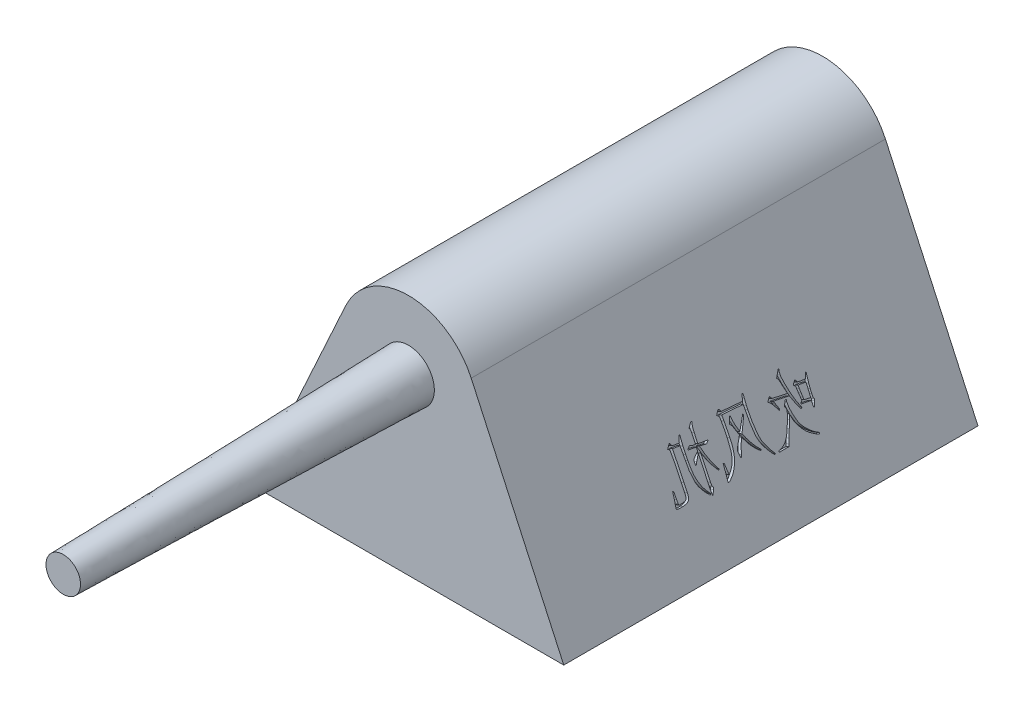
from build123d import *

# Parameters (mm, degrees)
SKETCH_1_W               = 120
SKETCH_1_H               = 120
EXTRUDE_1_DEPTH          = 60
CUT_EXTRUDE_1_DEPTH      = 181.0000001
CUT_EXTRUDE_1_DEPTH_BACK = 181.0000001
CUT_EXTRUDE_START        = -1
CUT_EXTRUDE_2_DEPTH      = 189.58894894


with BuildPart() as part:
    # 草图1 → 凸台-拉伸1 (new, symmetric)
    with BuildSketch(Plane.XY):
        with Locations((0, 60)):
            Rectangle(SKETCH_1_W, SKETCH_1_H)
    extrude(amount=EXTRUDE_1_DEPTH, both=True)

    # 放样1: read off the stored shape, not the designer's step
    # 放样1: loft between two sections, ruled curve by curve
    loft_1_from = [
        Edge.make_bspline([(4.574429183, 56.193449978, 60), (-7.312470774, 65.342308345, 60), (-16.46132914, 53.455408388, 60), (-4.574429183, 44.306550022, 60), (7.312470774, 35.157691655, 60), (16.46132914, 47.044591612, 60), (4.574429183, 56.193449978, 60)], [0, 0, 0, 0, 0.5, 0.5, 0.5, 1, 1, 1, 1], 3, [1, 0.333333333, 0.333333333, 1, 0.333333333, 0.333333333, 1]),
    ]
    loft_1_to = [
        Edge.make_bspline([(1.470201626, 55.028965074, 160), (-8.087728522, 57.969368326, 160), (-11.028131774, 48.411438178, 160), (-1.470201626, 45.471034926, 160), (8.087728522, 42.530631674, 160), (11.028131774, 52.088561822, 160), (1.470201626, 55.028965074, 160)], [0, 0, 0, 0, 0.5, 0.5, 0.5, 1, 1, 1, 1], 3, [1, 0.333333333, 0.333333333, 1, 0.333333333, 0.333333333, 1]),
    ]
    loft_1 = Solid(Shell([*[Face.make_surface_from_curves(loft_1_from[k], loft_1_to[k]) for k in range(1)], Face(Wire(loft_1_from)), Face(Wire(loft_1_to))]))
    add(loft_1)

    # 草图5 → 切除-拉伸1 (cut, two sides: drawn at the far end of the back side and taken through both)
    with BuildSketch(Plane.XY.offset(60).offset(-CUT_EXTRUDE_1_DEPTH_BACK)):
        with BuildLine():
            Line((-45, 0), (-18.185043309, 58.574914406))
            ThreePointArc((-18.185043309, 58.574914406), (0, 70.25), (18.185043309, 58.574914406))
            Line((18.185043309, 58.574914406), (45, 0))
            Line((45, 0), (60, 0))
            Line((60, 0), (60, 120))
            Line((60, 120), (-60, 120))
            Line((-60, 120), (-60, 0))
            Line((-60, 0), (-45, 0))
        make_face()
    extrude(amount=CUT_EXTRUDE_1_DEPTH + CUT_EXTRUDE_1_DEPTH_BACK, mode=Mode.SUBTRACT)

    # 草图6 → 切除-拉伸2 (cut)
    # profile 1 of 7: a face of its own
    with BuildSketch(Plane(origin=(-37.203277515, 17.031254514, 0), x_dir=(0, 0, 1), z_dir=(-0.9092521654318725, 0.4162457202872492, 0)).offset(CUT_EXTRUDE_START)):
        with BuildLine():
            Line((-21.544781071, 9.01724255), (-20.332718225, 9.171275537))
            Line((-20.332718225, 9.171275537), (-19.405995174, 9.322783392))
            Line((-19.405995174, 9.322783392), (-19.032275796, 9.88588759))
            add(Edge.make_bspline(
                [(-19.032275796, 9.88588759), (-19.014364065, 9.910011793), (-18.981033162, 9.954903125), (-18.894228659, 9.974480172), (-18.803901999, 9.941126115), (-18.753582279, 9.895086034), (-18.724209823, 9.868211673)],
                knots=[0, 0, 0, 0, 0.955847125, 1.778680574, 2.70337894, 4, 4, 4, 4], degree=3))
            Line((-18.724209823, 9.868211673), (-18.239384684, 9.358135226))
            add(Edge.make_bspline(
                [(-18.239384684, 9.358135226), (-18.208844668, 9.32630229), (-18.160215476, 9.275614371), (-18.132531419, 9.182858182), (-18.160284973, 9.112640134), (-18.209687108, 9.050222371), (-18.290388018, 8.981569889), (-18.393481748, 8.90716381), (-18.495197123, 8.827922988), (-18.574249325, 8.746092339), (-18.599003415, 8.630344322), (-18.622482992, 8.47342935), (-18.653359332, 8.235669115), (-18.669517408, 8.050151103), (-18.678757466, 7.944061905)],
                knots=[0, 0, 0, 0, 0.963202408, 1.53371736, 2.002232805, 2.557823776, 3.279141685, 4.323659278, 5.35045927, 6.140102405, 6.737918749, 7.900979441, 9.655959124, 12, 12, 12, 12], degree=3))
            Line((-18.678757466, 7.944061905), (-18.789863227, 6.936534664))
            Line((-18.789863227, 6.936534664), (-18.943896214, 5.863354019))
            Line((-18.943896214, 5.863354019), (-18.98682344, 5.368428357))
            Line((-18.98682344, 5.368428357), (-18.570176836, 4.959357146))
            add(Edge.make_bspline(
                [(-18.570176836, 4.959357146), (-18.540317188, 4.926565605), (-18.491933395, 4.873431049), (-18.459679545, 4.780146945), (-18.499809924, 4.710099711), (-18.545366549, 4.706357139), (-18.570176836, 4.704318922)],
                knots=[0, 0, 0, 0, 1.544190069, 2.502165192, 3.184274256, 4, 4, 4, 4], degree=3))
            Line((-18.570176836, 4.704318922), (-18.855516631, 4.67149222))
            Line((-18.855516631, 4.67149222), (-19.451447531, 4.603313685))
            Line((-19.451447531, 4.603313685), (-20.332718225, 4.4821074))
            Line((-20.332718225, 4.4821074), (-21.325094681, 4.277571795))
            Line((-21.325094681, 4.277571795), (-21.345295728, 3.785171264))
            Line((-21.345295728, 3.785171264), (-21.345295728, 3.323072303))
            add(Edge.make_bspline(
                [(-21.345295728, 3.323072303), (-21.345193494, 3.22617815), (-21.345000857, 3.043603485), (-21.387596717, 2.854013683), (-21.396968263, 2.706501259), (-21.478629624, 2.686545507), (-21.530487421, 2.778901692), (-21.565316126, 2.841152148), (-21.587708297, 2.881174391)],
                knots=[0, 0, 0, 0, 1.919209401, 3.616307091, 4.190654597, 4.487084434, 5.027311972, 6, 6, 6, 6], degree=3))
            Line((-21.587708297, 2.881174391), (-21.918500449, 3.494781207))
            Line((-21.918500449, 3.494781207), (-22.117985793, 3.921528334))
            add(Edge.make_bspline(
                [(-22.117985793, 3.921528334), (-22.134739935, 3.952323918), (-22.164136121, 4.006356688), (-22.193281073, 4.080964032), (-22.214531501, 4.133838518), (-22.220205814, 4.192677064), (-22.17434383, 4.272069196), (-22.109734919, 4.394199395), (-22.028756879, 4.570291867), (-21.999304211, 4.759749344), (-21.979468398, 4.940473836), (-21.970154312, 5.109926635), (-21.965889926, 5.30695523), (-21.964626203, 5.447545357), (-21.963952806, 5.522461343)],
                knots=[0, 0, 0, 0, 0.756838903, 1.327920955, 1.730710729, 1.986106387, 2.574043189, 3.624075137, 5.026598719, 6.714534166, 7.739352734, 8.960668023, 10.380437117, 12, 12, 12, 12], degree=3))
            Line((-21.963952806, 5.522461343), (-21.963952806, 6.68149644))
            Line((-21.963952806, 6.68149644), (-22.02960621, 7.926385988))
            add(Edge.make_bspline(
                [(-22.02960621, 7.926385988), (-22.031372589, 7.931412669), (-22.037137777, 7.947818981), (-22.043451906, 7.982613361), (-22.051312917, 8.037297102), (-22.057574861, 8.112480542), (-22.068779672, 8.208228917), (-22.078121743, 8.323634013), (-22.088606231, 8.459123024), (-22.100643901, 8.657025389), (-22.116358895, 8.891040795), (-22.133823596, 9.133473435), (-22.148523388, 9.316182043), (-22.162904484, 9.458451934), (-22.180382553, 9.60004913), (-22.209138508, 9.776566922), (-22.24688424, 10.00904148), (-22.277632577, 10.181374394), (-22.294744958, 10.277282884)],
                knots=[0, 0, 0, 0, 0.107894965, 0.352152582, 0.714043297, 1.228386643, 1.880236556, 2.6679437, 3.574678763, 4.634578627, 6.686285865, 8.328364293, 9.560919656, 10.401185252, 11.226423052, 12.452111758, 14.025492656, 16, 16, 16, 16], degree=3))
            Line((-22.294744958, 10.277282884), (-22.072533436, 10.380813252))
            Line((-22.072533436, 10.380813252), (-21.787193641, 9.681351985))
            Line((-21.787193641, 9.681351985), (-21.544781071, 9.01724255))
        make_face()
        Polygon((-21.368021906, 4.926530444), (-19.605480517, 5.249747203), (-19.517100935, 5.898705852), (-19.405995174, 6.868356129), (-19.297414544, 7.926385988), (-19.251962187, 8.676349874), (-20.663510377, 8.504640971), (-21.456401489, 8.368283901), (-21.456401489, 7.398633624), align=None, mode=Mode.SUBTRACT)
    # profile 2 of 7: a face of its own
    with BuildSketch(Plane(origin=(-37.203277515, 17.031254514, 0), x_dir=(0, 0, 1), z_dir=(-0.9092521654318725, 0.4162457202872492, 0)).offset(CUT_EXTRUDE_START)):
        with BuildLine():
            add(Edge.make_bspline(
                [(-14.20675059, 6.050213708), (-14.236119691, 6.010602565), (-14.290250146, 5.93759491), (-14.365676028, 5.838283128), (-14.417592786, 5.751331452), (-14.46211678, 5.675350655), (-14.497429569, 5.586575996), (-14.536714567, 5.468618719), (-14.590683764, 5.313727396), (-14.626405329, 5.196032675), (-14.646123371, 5.131066049)],
                knots=[0, 0, 0, 0, 1.151034013, 2.12148119, 2.906428436, 3.513111957, 4.173390575, 5.130023566, 6.41579397, 8, 8, 8, 8], degree=3))
            add(Edge.make_bspline(
                [(-14.646123371, 5.131066049), (-14.630262933, 5.084725986), (-14.595609271, 4.983477023), (-14.536612589, 4.821088168), (-14.475047911, 4.633106338), (-14.399820866, 4.420255344), (-14.310913473, 4.171345384), (-14.192781755, 3.884343651), (-14.05786264, 3.548532733), (-13.893412271, 3.173059175), (-13.706981366, 2.75865514), (-13.502281441, 2.308021833), (-13.277965991, 1.824646703), (-13.038925295, 1.317606785), (-12.783450741, 0.810618848), (-12.491053843, 0.338863114), (-12.181009948, -0.09653895), (-11.847197379, -0.485947551), (-11.496657835, -0.82804743), (-11.123108522, -1.101858859), (-10.736057634, -1.316639839), (-10.46285162, -1.405575905), (-10.328149482, -1.449425154)],
                knots=[0, 0, 0, 0, 0.361530957, 0.78991334, 1.275204663, 1.821455053, 2.456307885, 3.225843721, 4.111933012, 5.127622296, 6.251146752, 7.466183313, 8.781009372, 10.184448305, 11.604416628, 12.968366785, 14.277086751, 15.54603214, 16.750074257, 17.883382359, 18.956417836, 20, 20, 20, 20], degree=3))
            Line((-10.328149482, -1.449425154), (-9.886251569, -1.568106307))
            Line((-9.886251569, -1.568106307), (-9.378700252, -1.686787461))
            Line((-9.378700252, -1.686787461), (-9.40142643, -2.01000422))
            Line((-9.40142643, -2.01000422), (-9.754944761, -2.01000422))
            Line((-9.754944761, -2.01000422), (-11.605865732, -1.994853434))
            Line((-11.605865732, -1.994853434), (-12.244723857, -1.994853434))
            Line((-12.244723857, -1.994853434), (-12.44168407, -1.464575939))
            Line((-12.44168407, -1.464575939), (-12.906308161, -0.373719378))
            Line((-12.906308161, -0.373719378), (-13.699199273, 1.398922535))
            Line((-13.699199273, 1.398922535), (-14.426436981, 3.118536698))
            Line((-14.426436981, 3.118536698), (-14.865809762, 4.194242474))
            add(Edge.make_bspline(
                [(-14.865809762, 4.194242474), (-14.894144116, 4.081380659), (-14.95345122, 3.84514773), (-15.052008018, 3.477296875), (-15.163583377, 3.080738981), (-15.264625183, 2.731126785), (-15.363349865, 2.436671965), (-15.453715351, 2.199336031), (-15.569454112, 1.954494343), (-15.696720266, 1.695088208), (-15.848527698, 1.428869065), (-16.010364832, 1.146387473), (-16.199325449, 0.85869766), (-16.464586053, 0.460608437), (-16.818150294, -0.019293692), (-17.266760213, -0.554217803), (-17.73542979, -1.032550723), (-18.226096544, -1.466641212), (-18.761960978, -1.862589278), (-19.3481455, -2.25004125), (-20.00228475, -2.625826932), (-20.466248462, -2.860626407), (-20.706437603, -2.982179628)],
                knots=[0, 0, 0, 0, 0.725578599, 1.518720553, 2.374476111, 3.294438929, 3.787374669, 4.310774756, 4.876756707, 5.475287604, 6.111996682, 6.787111913, 7.504846396, 8.257427852, 9.770084747, 11.218933763, 12.607008462, 13.942067027, 15.299317642, 16.757906356, 18.321602176, 20, 20, 20, 20], degree=3))
            Line((-20.706437603, -2.982179628), (-20.840269542, -2.658962869))
            add(Edge.make_bspline(
                [(-20.840269542, -2.658962869), (-20.620902994, -2.541485823), (-20.168848279, -2.299397623), (-19.512389667, -1.850984683), (-18.852040128, -1.326626087), (-18.308595781, -0.837964016), (-17.887034738, -0.41694211), (-17.589053847, -0.095491723), (-17.317382766, 0.230868128), (-17.067504328, 0.556278459), (-16.844681845, 0.886848893), (-16.644345791, 1.217274072), (-16.468886168, 1.550899712), (-16.277380365, 1.991584183), (-16.072324031, 2.520937368), (-15.855552234, 3.120414506), (-15.682529729, 3.672184965), (-15.551335875, 4.172577016), (-15.456706597, 4.61744578), (-15.373154654, 4.997857201), (-15.314922292, 5.315487146), (-15.265576937, 5.644460089), (-15.227350528, 5.987062522), (-15.21061558, 6.297526334), (-15.204968685, 6.510658678), (-15.199177862, 6.636854354), (-15.196195923, 6.736193071), (-15.196480552, 6.79344279), (-15.196601914, 6.81785351)],
                knots=[0, 0, 0, 0, 1.670327638, 3.442090376, 5.329726787, 7.331136143, 8.346480277, 9.330657216, 10.273793721, 11.197551925, 12.0850147, 12.949825357, 13.791848953, 14.614385065, 16.175426639, 17.604121897, 18.895083644, 20.057844479, 21.076943021, 21.949534565, 22.673608081, 23.24525281, 24.18356523, 24.987592942, 25.332623598, 25.615509762, 25.836057126, 26, 26, 26, 26], degree=3))
            Line((-15.196601914, 6.81785351), (-15.242054271, 7.226924721))
            Line((-15.242054271, 7.226924721), (-15.02236788, 7.330455089))
            Line((-15.02236788, 7.330455089), (-14.20675059, 6.050213708))
        make_face()
    # profile 3 of 7: a face of its own
    with BuildSketch(Plane(origin=(-37.203277515, 17.031254514, 0), x_dir=(0, 0, 1), z_dir=(-0.9092521654318725, 0.4162457202872492, 0)).offset(CUT_EXTRUDE_START)):
        with BuildLine():
            add(Edge.make_bspline(
                [(-18.459071075, 4.040209488), (-18.29009409, 4.352142622), (-17.955635375, 4.969556617), (-17.595061426, 5.773953142), (-17.329744657, 6.438562766), (-17.128623835, 6.972350426), (-16.934136431, 7.546299288), (-16.736951495, 8.146732213), (-16.550717082, 8.755354928), (-16.380880439, 9.351253416), (-16.232667364, 9.924165665), (-16.121809414, 10.38428153), (-16.044439983, 10.73185958), (-15.990728367, 10.967385506), (-15.943616891, 11.181370642), (-15.899175516, 11.372770393), (-15.865998797, 11.542789216), (-15.83095456, 11.688404573), (-15.807282649, 11.813683857), (-15.763997874, 12.002273444), (-15.71926822, 12.249125183), (-15.70891213, 12.463853154), (-15.704153231, 12.562526375)],
                knots=[0, 0, 0, 0, 2.363647401, 4.678403234, 5.869030614, 7.132887299, 8.479332593, 9.907347447, 11.344642176, 12.720813804, 14.036490827, 15.288226456, 15.874767141, 16.409590551, 16.898169653, 17.335031251, 17.718988848, 18.052415481, 18.332949358, 18.5684171, 19.34214953, 20, 20, 20, 20], degree=3))
            Line((-15.704153231, 12.562526375), (-15.704153231, 12.817564599))
            add(Edge.make_bspline(
                [(-15.704153231, 12.817564599), (-15.704153231, 12.850391301), (-15.704153231, 12.908469313), (-15.704153231, 12.984223241), (-15.704153231, 13.03640928), (-15.704153231, 13.06334401), (-15.704153231, 13.072602823)],
                knots=[0, 0, 0, 0, 1.544554455, 2.732673267, 3.564356436, 4, 4, 4, 4], degree=3))
            add(Edge.make_bspline(
                [(-15.704153231, 13.072602823), (-15.70660177, 13.121512908), (-15.711909868, 13.227543299), (-15.741371349, 13.396594791), (-15.790134294, 13.587140803), (-15.834531433, 13.719316714), (-15.858186218, 13.789740007)],
                knots=[0, 0, 0, 0, 0.797400045, 1.728654511, 2.789827683, 4, 4, 4, 4], degree=3))
            Line((-15.858186218, 13.789740007), (-15.681427053, 13.890745244))
            Line((-15.681427053, 13.890745244), (-14.580469967, 12.307488151))
            add(Edge.make_bspline(
                [(-14.580469967, 12.307488151), (-14.617783028, 12.262274573), (-14.687236521, 12.178115276), (-14.779436648, 12.058109022), (-14.846816418, 11.95103679), (-14.902744409, 11.857182019), (-14.945797945, 11.75747123), (-14.986233827, 11.641418485), (-15.038929677, 11.505585333), (-15.070899117, 11.406211316), (-15.088021284, 11.35298866)],
                knots=[0, 0, 0, 0, 1.288957823, 2.399230266, 3.323161076, 4.06910296, 4.798097321, 5.70557479, 6.77115359, 8, 8, 8, 8], degree=3))
            Line((-15.088021284, 11.35298866), (-15.284981497, 10.75453263))
            Line((-15.284981497, 10.75453263), (-15.550120244, 9.800033138))
            Line((-15.550120244, 9.800033138), (-15.923839622, 8.640998041))
            Line((-15.923839622, 8.640998041), (-16.057671561, 8.249602747))
            Line((-16.057671561, 8.249602747), (-15.242054271, 8.368283901))
            Line((-15.242054271, 8.368283901), (-13.633545869, 8.658673958))
            Line((-13.633545869, 8.658673958), (-12.398756844, 8.898561396))
            Line((-12.398756844, 8.898561396), (-11.848278301, 8.999566633))
            Line((-11.848278301, 8.999566633), (-11.560413375, 9.476816379))
            add(Edge.make_bspline(
                [(-11.560413375, 9.476816379), (-11.547570413, 9.499240445), (-11.524543739, 9.539445471), (-11.487605988, 9.583952822), (-11.459768264, 9.617171604), (-11.411739267, 9.625374717), (-11.342593499, 9.578355911), (-11.287635854, 9.538049236), (-11.252347402, 9.512168212)],
                knots=[0, 0, 0, 0, 1.128210815, 2.02281538, 2.572202457, 2.949078882, 4.040995371, 6, 6, 6, 6], degree=3))
            Line((-11.252347402, 9.512168212), (-10.656416503, 8.898561396))
            add(Edge.make_bspline(
                [(-10.656416503, 8.898561396), (-10.627078701, 8.87013924), (-10.580199182, 8.824722851), (-10.551387673, 8.738042991), (-10.582643374, 8.67126641), (-10.617085086, 8.642066248), (-10.636215455, 8.625847256)],
                knots=[0, 0, 0, 0, 1.478409305, 2.362382767, 3.090398811, 4, 4, 4, 4], degree=3))
            Line((-10.636215455, 8.625847256), (-10.833175668, 8.504640971))
            add(Edge.make_bspline(
                [(-10.833175668, 8.504640971), (-10.877048509, 8.475539985), (-10.976103306, 8.409836642), (-11.118571922, 8.268261501), (-11.275818783, 8.083485723), (-11.447776139, 7.857163174), (-11.631629069, 7.596290879), (-11.829096895, 7.309253432), (-12.03289324, 6.994489867), (-12.172431979, 6.776668743), (-12.244723857, 6.663820524)],
                knots=[0, 0, 0, 0, 0.540554081, 1.220446954, 2.055412814, 3.037412428, 4.142664018, 5.338752017, 6.621267348, 8, 8, 8, 8], degree=3))
            Line((-12.244723857, 6.663820524), (-12.509862605, 6.221922611))
            Line((-12.509862605, 6.221922611), (-12.684096639, 5.931532554))
            Line((-12.684096639, 5.931532554), (-12.926509208, 6.118392243))
            Line((-12.926509208, 6.118392243), (-12.772476222, 6.444134133))
            Line((-12.772476222, 6.444134133), (-12.509862605, 7.040065032))
            Line((-12.509862605, 7.040065032), (-12.133618096, 7.840531537))
            Line((-12.133618096, 7.840531537), (-11.936657884, 8.28495458))
            Line((-11.936657884, 8.28495458), (-12.618443235, 8.199100129))
            Line((-12.618443235, 8.199100129), (-13.896159485, 7.994564523))
            Line((-13.896159485, 7.994564523), (-15.792532814, 7.671347764))
            Line((-15.792532814, 7.671347764), (-16.320285178, 7.55014148))
            add(Edge.make_bspline(
                [(-16.320285178, 7.55014148), (-16.336950532, 7.507986772), (-16.374421701, 7.413204131), (-16.440979561, 7.257362039), (-16.519092549, 7.069240861), (-16.612237374, 6.850263531), (-16.72131436, 6.600493519), (-16.844153153, 6.317794581), (-16.992162596, 6.007366955), (-17.145536563, 5.67925103), (-17.293538869, 5.368563555), (-17.426118387, 5.107395558), (-17.529407286, 4.907963283), (-17.606670124, 4.77863704), (-17.665319433, 4.691894686), (-17.709121912, 4.615431488), (-17.765674128, 4.525648934), (-17.828211045, 4.417376819), (-17.904796233, 4.296499699), (-17.984265007, 4.155820215), (-18.07641766, 4.001682849), (-18.140149567, 3.8929615), (-18.17373128, 3.835673882)],
                knots=[0, 0, 0, 0, 0.654120707, 1.470755945, 2.445298151, 3.59366084, 4.904718708, 6.378531444, 8.041345517, 9.867074198, 11.605582955, 13.007095096, 14.093869913, 14.845888038, 15.179425463, 15.604386984, 16.116857518, 16.710557414, 17.408438874, 18.181355744, 19.041717206, 20, 20, 20, 20], degree=3))
            Line((-18.17373128, 3.835673882), (-18.459071075, 4.040209488))
        make_face()
    # profile 4 of 7: a face of its own
    with BuildSketch(Plane(origin=(-37.203277515, 17.031254514, 0), x_dir=(0, 0, 1), z_dir=(-0.9092521654318725, 0.4162457202872492, 0)).offset(CUT_EXTRUDE_START)):
        with BuildLine():
            Line((-4.405707399, 11.676205419), (1.611679606, 12.08527663))
            Line((1.611679606, 12.08527663), (1.942471758, 12.663531612))
            add(Edge.make_bspline(
                [(1.942471758, 12.663531612), (1.967013263, 12.698019416), (2.005165429, 12.751634075), (2.071170209, 12.815584716), (2.130433668, 12.79892788), (2.1842974, 12.764708975), (2.255790884, 12.705952515), (2.308890984, 12.657885308), (2.338917314, 12.63070491)],
                knots=[0, 0, 0, 0, 1.51839777, 2.360497612, 2.807088493, 3.513210676, 4.593803816, 6, 6, 6, 6], degree=3))
            Line((2.338917314, 12.63070491), (2.801016274, 12.08527663))
            add(Edge.make_bspline(
                [(2.801016274, 12.08527663), (2.826624972, 12.054452285), (2.871482939, 12.000458228), (2.92553565, 11.926430137), (2.959018877, 11.873541005), (2.970331618, 11.826130825), (2.941624951, 11.785930463), (2.898878206, 11.737371781), (2.832068644, 11.667520389), (2.745520678, 11.590384304), (2.655987712, 11.510688127), (2.58438249, 11.43489484), (2.528480201, 11.374699661), (2.491616411, 11.319284038), (2.466584511, 11.258265955), (2.445531511, 11.182420649), (2.420418113, 11.086432605), (2.389841861, 10.965225165), (2.365666779, 10.805578975), (2.34316007, 10.597579686), (2.326644187, 10.33638464), (2.319871885, 10.144312095), (2.316191136, 10.039920577)],
                knots=[0, 0, 0, 0, 1.044024242, 1.828785125, 2.378039035, 2.688000948, 3.011610686, 3.586922041, 4.408467306, 5.509813933, 6.611160561, 7.525679535, 8.224641931, 8.747458651, 9.248217446, 9.934697367, 10.79592307, 11.832559166, 13.18737996, 14.995417318, 17.280006944, 20, 20, 20, 20], degree=3))
            Line((2.316191136, 10.039920577), (2.207610506, 7.95921269))
            add(Edge.make_bspline(
                [(2.207610506, 7.95921269), (2.195578655, 7.706740985), (2.171763236, 7.207007442), (2.180541134, 6.706787446), (2.184884327, 6.459284918)],
                knots=[0, 0, 0, 0, 1.010425292, 2, 2, 2, 2], degree=3))
            add(Edge.make_bspline(
                [(2.184884327, 6.459284918), (2.184694289, 6.38016325), (2.184283877, 6.209290255), (2.187883855, 5.935744123), (2.189596201, 5.62598064), (2.196170295, 5.155340888), (2.218154846, 4.513566897), (2.256812557, 3.841976032), (2.318820513, 3.271747258), (2.406292221, 2.817726761), (2.532042851, 2.34648184), (2.683748135, 1.868839147), (2.85803083, 1.413416329), (3.042717984, 1.005403789), (3.236533517, 0.659365981), (3.438108969, 0.371989619), (3.64368228, 0.135851121), (3.828260821, -0.078432017), (4.006049078, -0.261814471), (4.166754751, -0.420551151), (4.308627592, -0.541902222), (4.421049773, -0.639633989), (4.49297707, -0.692230326), (4.551563901, -0.746562073), (4.603565485, -0.683438263), (4.618475302, -0.577725061), (4.662701753, -0.397784972), (4.684615151, -0.253370455), (4.697389602, -0.169183772)],
                knots=[0, 0, 0, 0, 0.727184827, 1.570445271, 2.514270048, 3.574216181, 5.896307797, 8.415753772, 9.755312442, 11.164816641, 12.66028939, 14.235854405, 15.768794861, 17.139553625, 18.348575729, 19.408860575, 20.358752996, 21.224771452, 22.007179924, 22.707448978, 23.294009877, 23.738746288, 24.03595404, 24.195248211, 24.32118131, 24.65391963, 25.215300206, 26, 26, 26, 26], degree=3))
            Line((4.697389602, -0.169183772), (4.939802172, 1.959501601))
            Line((4.939802172, 1.959501601), (5.202415788, 1.959501601))
            add(Edge.make_bspline(
                [(5.202415788, 1.959501601), (5.212694986, 1.790327515), (5.232075304, 1.471368035), (5.256648463, 1.02270326), (5.279064272, 0.632277214), (5.288829452, 0.298721729), (5.303718619, 0.016890384), (5.311137437, -0.216496403), (5.325274192, -0.404868019), (5.332920411, -0.515124959), (5.336247728, -0.563104197)],
                knots=[0, 0, 0, 0, 1.61013961, 3.035744439, 4.268851562, 5.325134228, 6.205647194, 6.950000574, 7.543083886, 8, 8, 8, 8], degree=3))
            Line((5.336247728, -0.563104197), (5.42462731, -1.568106307))
            Line((5.42462731, -1.568106307), (5.444828358, -1.790317829))
            Line((5.444828358, -1.790317829), (5.467554536, -2.06303197))
            add(Edge.make_bspline(
                [(5.467554536, -2.06303197), (5.466502381, -2.087700315), (5.464706239, -2.129811814), (5.445011605, -2.183296038), (5.407339771, -2.218987269), (5.375680337, -2.216076052), (5.358973906, -2.214539825)],
                knots=[0, 0, 0, 0, 1.358784943, 2.319590991, 3.113261534, 4, 4, 4, 4], degree=3))
            add(Edge.make_bspline(
                [(5.358973906, -2.214539825), (5.331801479, -2.212288872), (5.269990868, -2.207168505), (5.171084955, -2.168976714), (5.052083995, -2.117217759), (4.917563397, -2.038871178), (4.761174254, -1.946520505), (4.591428177, -1.826130367), (4.401788649, -1.686476028), (4.118836519, -1.47489646), (3.76581686, -1.164186035), (3.370572322, -0.729810522), (2.998477332, -0.23862146), (2.661165763, 0.306530423), (2.36244535, 0.881816328), (2.109789488, 1.470372905), (1.912294082, 2.064271788), (1.770167205, 2.658314468), (1.67482787, 3.235931647), (1.596947794, 3.782198837), (1.545585735, 4.292691699), (1.520693141, 4.764649992), (1.51573086, 5.189973309), (1.512455675, 5.562011104), (1.513953738, 5.876890187), (1.52040195, 6.0678979), (1.523300024, 6.153744076)],
                knots=[0, 0, 0, 0, 0.199367275, 0.453511681, 0.771755619, 1.153648345, 1.594706742, 2.105732644, 2.680702738, 3.324889984, 4.700296345, 6.126691685, 7.631437191, 9.219892363, 10.829155661, 12.388532576, 13.919265133, 15.420196, 16.86951677, 18.217671881, 19.472565446, 20.636446415, 21.687569896, 22.596362086, 23.369151409, 24, 24, 24, 24], degree=3))
            add(Edge.make_bspline(
                [(1.523300024, 6.153744076), (1.524428264, 6.441610401), (1.526665109, 7.012333017), (1.537742844, 7.732101295), (1.558883842, 8.329621383), (1.579030969, 8.826239262), (1.604502092, 9.373349264), (1.624133842, 9.754589416), (1.634405785, 9.954066125)],
                knots=[0, 0, 0, 0, 1.362701216, 2.701685936, 3.407336604, 4.192917911, 5.054478424, 6, 6, 6, 6], degree=3))
            Line((1.634405785, 9.954066125), (1.720260236, 11.385815362))
            Line((1.720260236, 11.385815362), (-4.360255042, 11.012095984))
            add(Edge.make_bspline(
                [(-4.360255042, 11.012095984), (-4.361197617, 10.928768193), (-4.363168447, 10.754538098), (-4.364179578, 10.482612428), (-4.373014234, 10.188036181), (-4.383067793, 9.879158165), (-4.392435479, 9.57106574), (-4.403303816, 9.28157202), (-4.410781645, 9.017260521), (-4.41559778, 8.808521631), (-4.417319134, 8.638373831), (-4.427274389, 8.492077926), (-4.432392318, 8.323521679), (-4.44747145, 8.133527527), (-4.458853515, 7.921294554), (-4.473485694, 7.686346582), (-4.495525566, 7.429886302), (-4.513577522, 7.1518235), (-4.5406543, 6.854071803), (-4.566273867, 6.535538464), (-4.603990808, 6.198403821), (-4.639532534, 5.841909844), (-4.687455605, 5.467821389), (-4.734022512, 5.073626819), (-4.787819387, 4.660437018), (-4.843363141, 4.232106793), (-4.912198965, 3.797597713), (-5.002225014, 3.365624888), (-5.117605608, 2.941796246), (-5.247825479, 2.522908681), (-5.402671348, 2.112139211), (-5.576853524, 1.706291063), (-5.774405173, 1.308705464), (-6.061760512, 0.784956329), (-6.462405048, 0.147917068), (-6.979513987, -0.600191633), (-7.539437681, -1.330460607), (-7.945844365, -1.794186702), (-8.150476568, -2.027680137)],
                knots=[0, 0, 0, 0, 0.643311217, 1.345099554, 2.099091928, 2.918222345, 3.730858298, 4.478552766, 5.15460107, 5.772025204, 6.09048182, 6.467855794, 6.903642021, 7.392055902, 7.938833953, 8.544382109, 9.209189182, 9.925830726, 10.69531496, 11.51714696, 12.392586214, 13.313940401, 14.282695427, 15.303836807, 16.378170512, 17.499293331, 18.638034166, 19.773507552, 20.903613825, 22.027726586, 23.158598482, 24.290794989, 25.435729351, 26.584382177, 28.901387761, 31.240951927, 33.603743914, 36, 36, 36, 36], degree=3))
            Line((-8.150476568, -2.027680137), (-8.349961911, -1.805468615))
            add(Edge.make_bspline(
                [(-8.349961911, -1.805468615), (-8.294600916, -1.739487945), (-8.173544849, -1.595210185), (-7.991669822, -1.348351497), (-7.784179078, -1.061946579), (-7.601248319, -0.792320602), (-7.445273704, -0.550922111), (-7.316010798, -0.348370052), (-7.178717633, -0.12888101), (-7.039600116, 0.109885186), (-6.891668342, 0.365037035), (-6.735057409, 0.635940758), (-6.574867555, 0.926296215), (-6.406084052, 1.231080982), (-6.242720284, 1.554182076), (-6.089605383, 1.896298677), (-5.955232389, 2.257321562), (-5.830505247, 2.635273905), (-5.7194096, 3.031121368), (-5.624796685, 3.445261235), (-5.540604312, 3.876331656), (-5.472336525, 4.318967884), (-5.414379286, 4.760637482), (-5.357017946, 5.187067024), (-5.311399149, 5.593264691), (-5.263533041, 5.977464842), (-5.227051876, 6.341343666), (-5.192771083, 6.683733573), (-5.169033367, 7.005550259), (-5.138023933, 7.402603668), (-5.108298545, 7.876420004), (-5.087161024, 8.427099269), (-5.070148883, 8.958219058), (-5.068233158, 9.305935934), (-5.067291703, 9.476816379)],
                knots=[0, 0, 0, 0, 0.687098235, 1.502455122, 2.445607629, 3.509284093, 4.10168848, 4.738885665, 5.426607298, 6.167257443, 6.94367742, 7.780062668, 8.663986714, 9.589688239, 10.55985875, 11.552073306, 12.578697182, 13.63214657, 14.727228973, 15.857879503, 17.020959161, 18.231156619, 19.430815691, 20.575443145, 21.664267115, 22.692274124, 23.664650652, 24.582227538, 25.437834575, 26.239353828, 27.760141548, 29.225536708, 30.636530014, 32, 32, 32, 32], degree=3))
            Line((-5.067291703, 9.476816379), (-5.067291703, 10.413639954))
            add(Edge.make_bspline(
                [(-5.067291703, 10.413639954), (-5.070815443, 10.535684023), (-5.077400895, 10.763769895), (-5.084311716, 11.082815567), (-5.091809124, 11.356379199), (-5.099613902, 11.583603967), (-5.105544897, 11.76540023), (-5.106599018, 11.900963787), (-5.110526429, 11.990988894), (-5.110293592, 12.035614631), (-5.110218929, 12.049924797)],
                knots=[0, 0, 0, 0, 1.790160024, 3.345596489, 4.678964125, 5.80262674, 6.679202086, 7.345743105, 7.790198984, 8, 8, 8, 8], degree=3))
            Line((-5.110218929, 12.049924797), (-5.175872333, 13.158457275))
            Line((-5.175872333, 13.158457275), (-4.933459763, 13.176133191))
            Line((-4.933459763, 13.176133191), (-4.405707399, 11.676205419))
        make_face()
    # profile 5 of 7: a face of its own
    with BuildSketch(Plane(origin=(-37.203277515, 17.031254514, 0), x_dir=(0, 0, 1), z_dir=(-0.9092521654318725, 0.4162457202872492, 0)).offset(CUT_EXTRUDE_START)):
        with BuildLine():
            add(Edge.make_bspline(
                [(-1.408376986, 6.239598527), (-1.354709213, 6.372341096), (-1.251114609, 6.628573338), (-1.111460968, 7.003627743), (-0.980352379, 7.35068679), (-0.871567124, 7.674491531), (-0.770738446, 7.968672526), (-0.690809853, 8.238874274), (-0.62080467, 8.481320473), (-0.52685786, 8.899307486), (-0.412170325, 9.482174792), (-0.339769667, 9.996641241), (-0.304894769, 10.244456182)],
                knots=[0, 0, 0, 0, 1.030271669, 1.988727683, 2.879842816, 3.6996614, 4.44665973, 5.117316417, 5.727177847, 6.261977282, 8.199420231, 10, 10, 10, 10], degree=3))
            Line((-0.304894769, 10.244456182), (-0.107934557, 10.277282884))
            Line((-0.107934557, 10.277282884), (0.530923568, 8.74452841))
            add(Edge.make_bspline(
                [(0.530923568, 8.74452841), (0.479037764, 8.686921088), (0.378672033, 8.575487894), (0.243408761, 8.408048013), (0.127905674, 8.247556872), (0.045633279, 8.114159168), (-0.012418051, 7.998986735), (-0.06226125, 7.898504886), (-0.12200777, 7.78187325), (-0.183375328, 7.646328928), (-0.252492939, 7.493187454), (-0.32750587, 7.323195267), (-0.408307023, 7.135127591), (-0.522527306, 6.872285304), (-0.655842918, 6.555218996), (-0.802262278, 6.209263823), (-0.926835265, 5.917047924), (-0.999494475, 5.738859424), (-1.032132477, 5.658818413)],
                knots=[0, 0, 0, 0, 1.069596706, 2.06898315, 2.968127237, 3.796698399, 4.227815779, 4.747196615, 5.344484576, 6.035573426, 6.799698966, 7.662871788, 8.599198905, 9.623972963, 11.617103263, 13.344893696, 14.807345074, 16, 16, 16, 16], degree=3))
            Line((-1.032132477, 5.658818413), (0.50819739, 3.34074822))
            add(Edge.make_bspline(
                [(0.50819739, 3.34074822), (0.534910575, 3.295583638), (0.581386652, 3.217005494), (0.636094452, 3.108256158), (0.680541149, 3.017034657), (0.687351508, 2.912084169), (0.678983008, 2.7767568), (0.670094007, 2.67160915), (0.664755508, 2.60846025)],
                knots=[0, 0, 0, 0, 1.218498449, 2.119965317, 2.839522687, 3.548355801, 4.527607294, 6, 6, 6, 6], degree=3))
            Line((0.664755508, 2.60846025), (0.487996343, 1.482251856))
            add(Edge.make_bspline(
                [(0.487996343, 1.482251856), (0.477283075, 1.429834482), (0.458519844, 1.338030623), (0.421417222, 1.221760031), (0.374637026, 1.145661907), (0.315343089, 1.109648926), (0.258258996, 1.120283383), (0.213419536, 1.153987466), (0.176624045, 1.207767369), (0.164150161, 1.252697378), (0.157204191, 1.27771625)],
                knots=[0, 0, 0, 0, 1.92489692, 3.371267028, 4.371105961, 5.089040675, 5.701501688, 6.331676069, 7.071008786, 8, 8, 8, 8], degree=3))
            Line((0.157204191, 1.27771625), (0.023372252, 1.739815211))
            add(Edge.make_bspline(
                [(0.023372252, 1.739815211), (-0.062711595, 2.004400116), (-0.237511312, 2.54165964), (-0.563642636, 3.340597281), (-0.935607371, 4.151867471), (-1.218860805, 4.687123697), (-1.362924629, 4.959357146)],
                knots=[0, 0, 0, 0, 0.950725092, 1.930518715, 2.947453576, 4, 4, 4, 4], degree=3))
            add(Edge.make_bspline(
                [(-1.362924629, 4.959357146), (-1.398472274, 4.904771082), (-1.474043117, 4.788726409), (-1.589903959, 4.601640291), (-1.715865132, 4.391361033), (-1.853836725, 4.160689935), (-2.002321151, 3.911248653), (-2.160947903, 3.64531523), (-2.333869427, 3.366281782), (-2.515751237, 3.063545101), (-2.735398423, 2.737893904), (-3.006341444, 2.384046652), (-3.331814821, 1.993456787), (-3.636960419, 1.654789422), (-3.893589145, 1.376792161), (-4.083091677, 1.18152215), (-4.259071861, 0.998970234), (-4.425494876, 0.833560628), (-4.585297298, 0.688769989), (-4.730740074, 0.556152838), (-4.867677617, 0.442155406), (-4.956830702, 0.373468626), (-4.999113168, 0.340892676)],
                knots=[0, 0, 0, 0, 0.66063575, 1.404447467, 2.231617105, 3.146627505, 4.130449784, 5.175756327, 6.28699079, 7.459740638, 8.757219543, 10.268221799, 11.977674551, 13.912340013, 14.890889059, 15.81461857, 16.671856411, 17.462633115, 18.193647221, 18.858625871, 19.458682644, 20, 20, 20, 20], degree=3))
            Line((-4.999113168, 0.340892676), (-5.153146154, 0.545428281))
            add(Edge.make_bspline(
                [(-5.153146154, 0.545428281), (-4.997168911, 0.708656625), (-4.676449767, 1.044285424), (-4.21993983, 1.59597604), (-3.758741281, 2.194148885), (-3.308758771, 2.840005197), (-2.871278999, 3.510458984), (-2.461910694, 4.194000649), (-2.081977585, 4.878755365), (-1.852685091, 5.34308704), (-1.739169137, 5.572963962)],
                knots=[0, 0, 0, 0, 0.887804903, 1.825497255, 2.814839836, 3.858279355, 4.92077483, 5.963263185, 6.991671653, 8, 8, 8, 8], degree=3))
            add(Edge.make_bspline(
                [(-1.739169137, 5.572963962), (-1.798661126, 5.69009939), (-1.921918936, 5.932785111), (-2.118798312, 6.307058136), (-2.336532683, 6.701458769), (-2.568317298, 7.12021548), (-2.822320733, 7.557792674), (-3.088154242, 8.021112712), (-3.377536859, 8.502894121), (-3.576512946, 8.831292828), (-3.678469691, 8.999566633)],
                knots=[0, 0, 0, 0, 0.80059863, 1.658711284, 2.57691387, 3.545917854, 4.575311634, 5.660071348, 6.801004114, 8, 8, 8, 8], degree=3))
            Line((-3.678469691, 8.999566633), (-3.478984348, 9.204102239))
            add(Edge.make_bspline(
                [(-3.478984348, 9.204102239), (-3.305230891, 8.975202253), (-2.951975315, 8.509829088), (-2.436517567, 7.784081784), (-1.917045239, 7.026692273), (-1.579706119, 6.504706657), (-1.408376986, 6.239598527)],
                knots=[0, 0, 0, 0, 0.953336855, 1.938215017, 2.952852447, 4, 4, 4, 4], degree=3))
        make_face()
    # profile 6 of 7: a face of its own
    with BuildSketch(Plane(origin=(-37.203277515, 17.031254514, 0), x_dir=(0, 0, 1), z_dir=(-0.9092521654318725, 0.4162457202872492, 0)).offset(CUT_EXTRUDE_START)):
        with BuildLine():
            Line((10.619831685, -2.28271836), (10.816791898, -2.027680137))
            Line((10.816791898, -2.027680137), (11.104656823, -1.686787461))
            add(Edge.make_bspline(
                [(11.104656823, -1.686787461), (11.153123628, -1.627409027), (11.261744165, -1.494334084), (11.429740347, -1.263952146), (11.620472702, -0.981619783), (11.840037092, -0.655369062), (12.070399046, -0.280877484), (12.285684273, 0.144854478), (12.503129792, 0.608279487), (12.703598629, 1.10595507), (12.889206291, 1.61197001), (13.050456357, 2.104805944), (13.176393292, 2.575629464), (13.309335505, 3.178503344), (13.425829013, 3.941749769), (13.497557739, 4.710980947), (13.535088099, 5.317055058), (13.561816691, 5.726003575), (13.578308943, 6.084731841), (13.589325596, 6.306097042), (13.59443592, 6.4087823)],
                knots=[0, 0, 0, 0, 0.479132545, 1.073799566, 1.781715518, 2.609258317, 3.532509277, 4.528092239, 5.589910749, 6.732273641, 7.880982203, 8.959362707, 9.972905167, 10.926680513, 12.817909454, 14.795118958, 15.754943283, 16.614316414, 17.357219316, 18, 18, 18, 18], degree=3))
            Line((13.59443592, 6.4087823), (13.614636968, 7.7395263))
            add(Edge.make_bspline(
                [(13.614636968, 7.7395263), (13.618239977, 7.860727023), (13.625120318, 8.092173121), (13.631260695, 8.42301721), (13.641180829, 8.721750798), (13.641734962, 8.98863262), (13.645476137, 9.224294951), (13.645311502, 9.428001688), (13.643485325, 9.599756438), (13.63925523, 9.703242242), (13.637363146, 9.74953052)],
                knots=[0, 0, 0, 0, 1.447463798, 2.764091168, 3.950133117, 5.015263865, 5.949777807, 6.763662255, 7.446997152, 8, 8, 8, 8], degree=3))
            Line((13.637363146, 9.74953052), (13.528782516, 12.171131081))
            Line((13.528782516, 12.171131081), (13.814122311, 12.203957783))
            Line((13.814122311, 12.203957783), (14.29894745, 10.671203309))
            Line((14.29894745, 10.671203309), (15.488284117, 10.822711165))
            Line((15.488284117, 10.822711165), (16.260974182, 10.959068235))
            Line((16.260974182, 10.959068235), (16.591766334, 11.471669814))
            add(Edge.make_bspline(
                [(16.591766334, 11.471669814), (16.614289986, 11.505916123), (16.653356168, 11.565314688), (16.705042953, 11.643399098), (16.734166627, 11.685537141), (16.753248225, 11.722693476), (16.78587447, 11.701345018), (16.821277386, 11.666655951), (16.886002759, 11.601534268), (16.936202518, 11.551411003), (16.965485711, 11.522172432)],
                knots=[0, 0, 0, 0, 1.703333469, 2.954349385, 3.734066106, 4.053956075, 4.318200088, 5.055867123, 6.282589155, 8, 8, 8, 8], degree=3))
            Line((16.965485711, 11.522172432), (17.473037028, 10.943917449))
            Line((17.473037028, 10.943917449), (17.627070015, 10.772208546))
            add(Edge.make_bspline(
                [(17.627070015, 10.772208546), (17.623540197, 10.761671802), (17.614250474, 10.733941357), (17.570345152, 10.698907487), (17.50932015, 10.651872503), (17.457571766, 10.620946018), (17.427584671, 10.603024774)],
                knots=[0, 0, 0, 0, 0.492642308, 1.296528578, 2.433395443, 4, 4, 4, 4], degree=3))
            add(Edge.make_bspline(
                [(17.427584671, 10.603024774), (17.390046562, 10.575932421), (17.316034753, 10.522515932), (17.228015182, 10.415062032), (17.165154796, 10.289734305), (17.121716963, 10.136673875), (17.101911663, 9.93654189), (17.075167118, 9.669112475), (17.051480977, 9.322959617), (17.032214668, 8.976984562), (17.020603341, 8.635931184), (17.006373508, 8.302723544), (16.997784065, 7.90198371), (16.988185045, 7.433127668), (16.973853955, 6.897867164), (16.966033282, 6.294284461), (16.951309454, 5.624347756), (16.945696606, 5.154641125), (16.942759533, 4.908854527)],
                knots=[0, 0, 0, 0, 0.381583482, 0.752347002, 1.135261483, 1.533983708, 2.06067371, 2.794878711, 3.758005963, 4.92911925, 5.660547169, 6.580049004, 7.687187213, 8.975260425, 10.458347177, 12.115282719, 13.967217447, 16, 16, 16, 16], degree=3))
            Line((16.942759533, 4.908854527), (16.922558486, 3.085709996))
            add(Edge.make_bspline(
                [(16.922558486, 3.085709996), (16.918949583, 2.951883168), (16.911959138, 2.69266055), (16.905768202, 2.316370945), (16.895974997, 1.966279473), (16.895375849, 1.640486817), (16.891681329, 1.340010239), (16.891883137, 1.063916826), (16.893977611, 0.813906134), (16.89795106, 0.655688812), (16.899832307, 0.580780114)],
                knots=[0, 0, 0, 0, 1.282471821, 2.484148411, 3.60520942, 4.637344512, 5.604975229, 6.483875947, 7.282184294, 8, 8, 8, 8], degree=3))
            add(Edge.make_bspline(
                [(16.899832307, 0.580780114), (16.900547509, 0.478110169), (16.901978104, 0.272742693), (16.906272068, -0.026603799), (16.928204261, -0.299165667), (16.947309437, -0.506341924), (17.001760537, -0.648825305), (17.078055841, -0.740941983), (17.187124875, -0.819453136), (17.327320664, -0.896096281), (17.511708895, -0.953584753), (17.740282468, -1.004361623), (18.01942744, -1.037201881), (18.222090004, -1.0490848), (18.331581544, -1.055504729)],
                knots=[0, 0, 0, 0, 1.385344515, 2.771061259, 4.034724567, 5.080177443, 5.558837385, 6.067785299, 6.667341301, 7.363332852, 8.214344652, 9.261214841, 10.520329549, 12, 12, 12, 12], degree=3))
            add(Edge.make_bspline(
                [(18.331581544, -1.055504729), (18.393849718, -1.060016903), (18.511585242, -1.068548441), (18.678300577, -1.076005613), (18.823990805, -1.079550241), (18.948096911, -1.075521758), (19.050210347, -1.062645409), (19.132014584, -1.046435432), (19.19427859, -1.023214906), (19.248306564, -0.979638421), (19.289402394, -0.910093878), (19.326806261, -0.8186957), (19.355964445, -0.712769157), (19.363090053, -0.636534349), (19.366885226, -0.595930899)],
                knots=[0, 0, 0, 0, 1.67473329, 3.166555109, 4.476392444, 5.58373597, 6.493966742, 7.233614069, 7.820695276, 8.254443804, 9.068578956, 9.949200767, 10.907723074, 12, 12, 12, 12], degree=3))
            Line((19.366885226, -0.595930899), (19.412337582, 0.290390057))
            Line((19.412337582, 0.290390057), (19.477990986, 1.891323066))
            Line((19.477990986, 1.891323066), (19.500717165, 2.19938904))
            Line((19.500717165, 2.19938904), (19.743129734, 2.19938904))
            Line((19.743129734, 2.19938904), (19.78605696, 1.858496364))
            Line((19.78605696, 1.858496364), (19.874436542, 0.989851324))
            Line((19.874436542, 0.989851324), (20.028469529, -0.017675917))
            Line((20.028469529, -0.017675917), (20.182502516, -0.919147658))
            add(Edge.make_bspline(
                [(20.182502516, -0.919147658), (20.190621148, -0.981962982), (20.205658905, -1.098312828), (20.253366192, -1.247625309), (20.302424714, -1.359423067), (20.296019077, -1.424814641), (20.293608277, -1.449425154)],
                knots=[0, 0, 0, 0, 1.388543468, 2.571933269, 3.46253849, 4, 4, 4, 4], degree=3))
            add(Edge.make_bspline(
                [(20.293608277, -1.449425154), (20.275936834, -1.477168721), (20.235407298, -1.540798722), (20.119297503, -1.605770003), (19.961652775, -1.656029067), (19.756383227, -1.697580001), (19.50227861, -1.726219202), (19.199613823, -1.742586545), (18.848353981, -1.747217987), (18.59839374, -1.740737653), (18.465413484, -1.73729008)],
                knots=[0, 0, 0, 0, 0.409677882, 0.93959814, 1.624298287, 2.502703024, 3.571644685, 4.847402622, 6.322800432, 8, 8, 8, 8], degree=3))
            add(Edge.make_bspline(
                [(18.465413484, -1.73729008), (18.324740562, -1.731618185), (18.055220569, -1.72075121), (17.669251796, -1.674969366), (17.3231875, -1.595564743), (17.01434342, -1.497895095), (16.754173014, -1.357191452), (16.547784078, -1.173534305), (16.404168746, -0.943573793), (16.305981748, -0.589680551), (16.259331979, -0.134495322), (16.260434945, 0.230584486), (16.260974182, 0.409071211)],
                knots=[0, 0, 0, 0, 1.149503451, 2.202372419, 3.167817533, 4.045931193, 4.839698344, 5.564658363, 6.277924711, 7.019251869, 8.542718719, 10, 10, 10, 10], degree=3))
            Line((16.260974182, 0.409071211), (16.281175229, 2.658962869))
            Line((16.281175229, 2.658962869), (16.39228099, 10.363137336))
            Line((16.39228099, 10.363137336), (14.341874675, 10.072747279))
            add(Edge.make_bspline(
                [(14.341874675, 10.072747279), (14.334870443, 9.99364792), (14.321835914, 9.846447922), (14.307641624, 9.64177046), (14.294134853, 9.471023643), (14.285430218, 9.318648438), (14.280995, 9.154420144), (14.27287792, 8.945696733), (14.262436327, 8.677231013), (14.249460105, 8.227711238), (14.230775986, 7.595515172), (14.20712519, 6.924609708), (14.179108995, 6.342306492), (14.159261472, 5.857181258), (14.122309374, 5.332331377), (14.097631205, 4.867268246), (14.064667218, 4.469107521), (14.029513891, 4.143126664), (13.980984795, 3.794603894), (13.92031219, 3.423313173), (13.846260428, 3.030480918), (13.763390198, 2.61435346), (13.665549874, 2.176387094), (13.564732635, 1.714632645), (13.430210032, 1.237936818), (13.244735189, 0.754427328), (13.006679189, 0.266949796), (12.726411995, -0.228986555), (12.396360534, -0.72926116), (12.018716373, -1.23441601), (11.593559944, -1.745756457), (11.283909409, -2.078816078), (11.124857871, -2.249891658)],
                knots=[0, 0, 0, 0, 0.54479983, 1.013845578, 1.407596635, 1.719920303, 2.060833137, 2.53468901, 3.153031357, 3.904119315, 5.620042012, 7.492381671, 8.509807636, 9.619799501, 10.823315518, 12.11940969, 12.81479572, 13.564127784, 14.36857728, 15.228722296, 16.145035512, 17.111096659, 18.139606733, 19.223883122, 20.353456487, 21.534271984, 22.771468936, 24.072250439, 25.440101694, 26.880360847, 28.397601972, 30, 30, 30, 30], degree=3))
            Line((11.124857871, -2.249891658), (10.839518076, -2.555432501))
            Line((10.839518076, -2.555432501), (10.619831685, -2.28271836))
        make_face()
    # profile 7 of 7: a face of its own
    with BuildSketch(Plane(origin=(-37.203277515, 17.031254514, 0), x_dir=(0, 0, 1), z_dir=(-0.9092521654318725, 0.4162457202872492, 0)).offset(CUT_EXTRUDE_START)):
        with BuildLine():
            Line((6.607398638, 1.381246619), (6.784157803, 1.653960759))
            add(Edge.make_bspline(
                [(6.784157803, 1.653960759), (6.847370216, 1.757440693), (6.968075146, 1.95503698), (7.139237791, 2.238174768), (7.295261308, 2.492383024), (7.426172165, 2.723203259), (7.547810631, 2.921665319), (7.645194462, 3.09751717), (7.728339114, 3.24398316), (7.797611484, 3.373536429), (7.861220243, 3.503362758), (7.935174853, 3.649043615), (8.018152631, 3.822185038), (8.114709044, 4.020983923), (8.219813952, 4.24786448), (8.336408223, 4.50140308), (8.46429125, 4.781266099), (8.657299071, 5.192323713), (8.892883463, 5.743360899), (9.15752629, 6.438515176), (9.405967459, 7.168571472), (9.552743855, 7.670763008), (9.62745523, 7.926385988)],
                knots=[0, 0, 0, 0, 1.052719017, 2.010180725, 2.872389378, 3.641922531, 4.313645063, 4.892821024, 5.386812736, 5.77582338, 6.167978425, 6.641832437, 7.194156131, 7.834751062, 8.560502815, 9.364845645, 10.257483046, 11.231778774, 13.307189855, 15.458216775, 17.688164616, 20, 20, 20, 20], degree=3))
            add(Edge.make_bspline(
                [(9.62745523, 7.926385988), (9.514635722, 7.907199992), (9.298130805, 7.870381338), (8.987549873, 7.814730829), (8.705437422, 7.762337243), (8.451386874, 7.71106858), (8.225460143, 7.66452792), (8.028224271, 7.617467079), (7.857958416, 7.579448343), (7.755360058, 7.54895904), (7.708355723, 7.534990694)],
                knots=[0, 0, 0, 0, 1.401640908, 2.689802115, 3.86455904, 4.915900294, 5.864183118, 6.689438353, 7.399580265, 8, 8, 8, 8], degree=3))
            Line((7.708355723, 7.534990694), (7.137676133, 7.976888607))
            add(Edge.make_bspline(
                [(7.137676133, 7.976888607), (7.109827311, 7.9959565), (7.064407427, 8.027055174), (7.004780405, 8.081245474), (7.024586326, 8.128832164), (7.07006879, 8.147415905), (7.13616095, 8.167847139), (7.191219587, 8.176403145), (7.223530585, 8.181424212)],
                knots=[0, 0, 0, 0, 1.554069129, 2.534600497, 2.931213883, 3.575381795, 4.577119991, 6, 6, 6, 6], degree=3))
            Line((7.223530585, 8.181424212), (8.281560444, 8.300105366))
            Line((8.281560444, 8.300105366), (9.142630091, 8.421311651))
            Line((9.142630091, 8.421311651), (9.824415442, 8.504640971))
            Line((9.824415442, 8.504640971), (9.824415442, 11.02724677))
            add(Edge.make_bspline(
                [(9.824415442, 11.02724677), (9.823977833, 11.169502959), (9.823172453, 11.431312595), (9.816252355, 11.800082888), (9.80099384, 12.133375503), (9.766312256, 12.404862274), (9.730469924, 12.641612875), (9.685825372, 12.855034307), (9.63081329, 13.10621272), (9.585898613, 13.284836751), (9.561801825, 13.380668797)],
                knots=[0, 0, 0, 0, 1.436088393, 2.642990677, 3.723800493, 4.802035156, 5.404153663, 6.140737966, 7.002503286, 8, 8, 8, 8], degree=3))
            Line((9.561801825, 13.380668797), (9.758762038, 13.517025867))
            Line((9.758762038, 13.517025867), (10.773864672, 12.390817472))
            add(Edge.make_bspline(
                [(10.773864672, 12.390817472), (10.733942508, 12.322045371), (10.659451252, 12.193722662), (10.55627791, 12.002711332), (10.488407136, 11.791623206), (10.462808809, 11.591142815), (10.455879518, 11.400972911), (10.446226573, 11.229357871), (10.44596082, 11.033967602), (10.444073638, 10.895935097), (10.44307252, 10.822711165)],
                knots=[0, 0, 0, 0, 1.167815512, 2.179041319, 3.179337916, 4.402512957, 5.132454845, 5.973475618, 6.924962751, 8, 8, 8, 8], degree=3))
            Line((10.44307252, 10.822711165), (10.420346342, 8.608171339))
            add(Edge.make_bspline(
                [(10.420346342, 8.608171339), (10.567894361, 8.637312035), (10.85665111, 8.694341417), (11.276552502, 8.797690986), (11.673043031, 8.916207492), (11.927344285, 9.006135645), (12.051580922, 9.050069252)],
                knots=[0, 0, 0, 0, 1.0665301, 2.087237531, 3.065536751, 4, 4, 4, 4], degree=3))
            Line((12.051580922, 9.050069252), (12.624785643, 8.557668721))
            add(Edge.make_bspline(
                [(12.624785643, 8.557668721), (12.649001356, 8.52541957), (12.685979869, 8.476173623), (12.753189423, 8.418305419), (12.733321718, 8.376766667), (12.686955798, 8.373503245), (12.624005869, 8.356186733), (12.568915618, 8.354266357), (12.536406061, 8.353133115)],
                knots=[0, 0, 0, 0, 1.856308752, 2.834669369, 3.078414649, 3.652927785, 4.614958566, 6, 6, 6, 6], degree=3))
            Line((12.536406061, 8.353133115), (11.324343214, 8.181424212))
            Line((11.324343214, 8.181424212), (10.44307252, 8.045067142))
            Line((10.44307252, 8.045067142), (10.44307252, 7.176422102))
            Line((10.44307252, 7.176422102), (11.059204467, 6.716848273))
            Line((11.059204467, 6.716848273), (11.521303427, 6.375955598))
            Line((11.521303427, 6.375955598), (11.874821757, 6.103241457))
            add(Edge.make_bspline(
                [(11.874821757, 6.103241457), (11.900917456, 6.082242688), (11.947909861, 6.044428692), (12.010221043, 5.993692354), (12.049015302, 5.947448934), (12.074756293, 5.905194532), (12.087454124, 5.851286036), (12.095284434, 5.774175709), (12.10950336, 5.667527485), (12.114472745, 5.585642363), (12.117234326, 5.54013726)],
                knots=[0, 0, 0, 0, 1.236525204, 2.226699979, 2.954207611, 3.454862032, 4.034910248, 4.974631651, 6.318745868, 8, 8, 8, 8], degree=3))
            Line((12.117234326, 5.54013726), (12.074307101, 4.790173374))
            add(Edge.make_bspline(
                [(12.074307101, 4.790173374), (12.073861485, 4.759862897), (12.07306743, 4.705851818), (12.067014217, 4.634379363), (12.053686443, 4.582913323), (12.029856041, 4.544687944), (11.97984839, 4.529061647), (11.95444171, 4.554163095), (11.940475161, 4.567961852)],
                knots=[0, 0, 0, 0, 1.565712468, 2.789986437, 3.697776169, 4.28910341, 5.059486685, 6, 6, 6, 6], degree=3))
            Line((11.940475161, 4.567961852), (11.763715996, 4.840675992))
            Line((11.763715996, 4.840675992), (11.501102379, 5.249747203))
            add(Edge.make_bspline(
                [(11.501102379, 5.249747203), (11.410670707, 5.380546053), (11.233485333, 5.636823995), (10.964800858, 6.008197254), (10.703328569, 6.361154633), (10.528421945, 6.588321453), (10.44307252, 6.699172357)],
                knots=[0, 0, 0, 0, 1.063178496, 2.083116155, 3.064615568, 4, 4, 4, 4], degree=3))
            Line((10.44307252, 6.699172357), (10.397620163, -0.850969123))
            Line((10.397620163, -0.850969123), (10.354692937, -2.232215742))
            add(Edge.make_bspline(
                [(10.354692937, -2.232215742), (10.350198343, -2.325231251), (10.342412755, -2.486353766), (10.325951655, -2.698564509), (10.298466506, -2.826329659), (10.268610528, -2.919558341), (10.197712469, -2.92152637), (10.147582298, -2.860057368), (10.087201835, -2.768375066), (10.047381621, -2.688428905), (10.023900786, -2.641286952)],
                knots=[0, 0, 0, 0, 2.088579197, 3.617860454, 4.657194462, 5.179233613, 5.499191944, 6.018858948, 6.831778084, 8, 8, 8, 8], degree=3))
            Line((10.023900786, -2.641286952), (9.604729051, -1.823144531))
            add(Edge.make_bspline(
                [(9.604729051, -1.823144531), (9.5816991, -1.777037156), (9.540998927, -1.69555291), (9.491645659, -1.587034505), (9.46361226, -1.508887611), (9.442812194, -1.435310942), (9.481508268, -1.342253052), (9.552054141, -1.232722678), (9.632692762, -1.108326449), (9.690895233, -0.965348638), (9.718879337, -0.788669924), (9.736311844, -0.572448482), (9.756181437, -0.340622401), (9.773621962, -0.187668449), (9.781488216, -0.118681154)],
                knots=[0, 0, 0, 0, 1.032079481, 1.823964536, 2.378053678, 2.705120646, 3.318280834, 4.27739988, 5.357833658, 6.264954215, 7.345256673, 8.919142163, 10.610431135, 12, 12, 12, 12], degree=3))
            Line((9.781488216, -0.118681154), (9.824415442, 6.459284918))
            add(Edge.make_bspline(
                [(9.824415442, 6.459284918), (9.758332938, 6.299190787), (9.628532592, 5.984731247), (9.429748721, 5.523131768), (9.223789509, 5.083819775), (9.023996386, 4.65971138), (8.81554002, 4.25961075), (8.609415994, 3.877222821), (8.399275884, 3.515387126), (8.18849566, 3.175631792), (7.985391797, 2.859799224), (7.79480915, 2.5724323), (7.624191751, 2.310472165), (7.46491312, 2.080265874), (7.324088836, 1.875746963), (7.194492664, 1.703322544), (7.085335197, 1.555461838), (7.0134821, 1.47016752), (6.981118015, 1.431749237)],
                knots=[0, 0, 0, 0, 1.434431949, 2.817534945, 4.161813054, 5.4526661, 6.69978629, 7.897613976, 9.050224986, 10.164549908, 11.208745338, 12.160008972, 13.020392555, 13.797690216, 14.478432168, 15.07656453, 15.584066028, 16, 16, 16, 16], degree=3))
            Line((6.981118015, 1.431749237), (6.827085029, 1.227213632))
            Line((6.827085029, 1.227213632), (6.607398638, 1.381246619))
        make_face()
    cut_extrude_2 = extrude(amount=CUT_EXTRUDE_2_DEPTH, mode=Mode.SUBTRACT)

    # 镜向1: 切除-拉伸2 across plane
    add(cut_extrude_2.mirror(Plane(origin=(0, 0, 0), x_dir=(0, 0, 1), z_dir=(1, 0, 0))), mode=Mode.SUBTRACT)


solid = part.part
